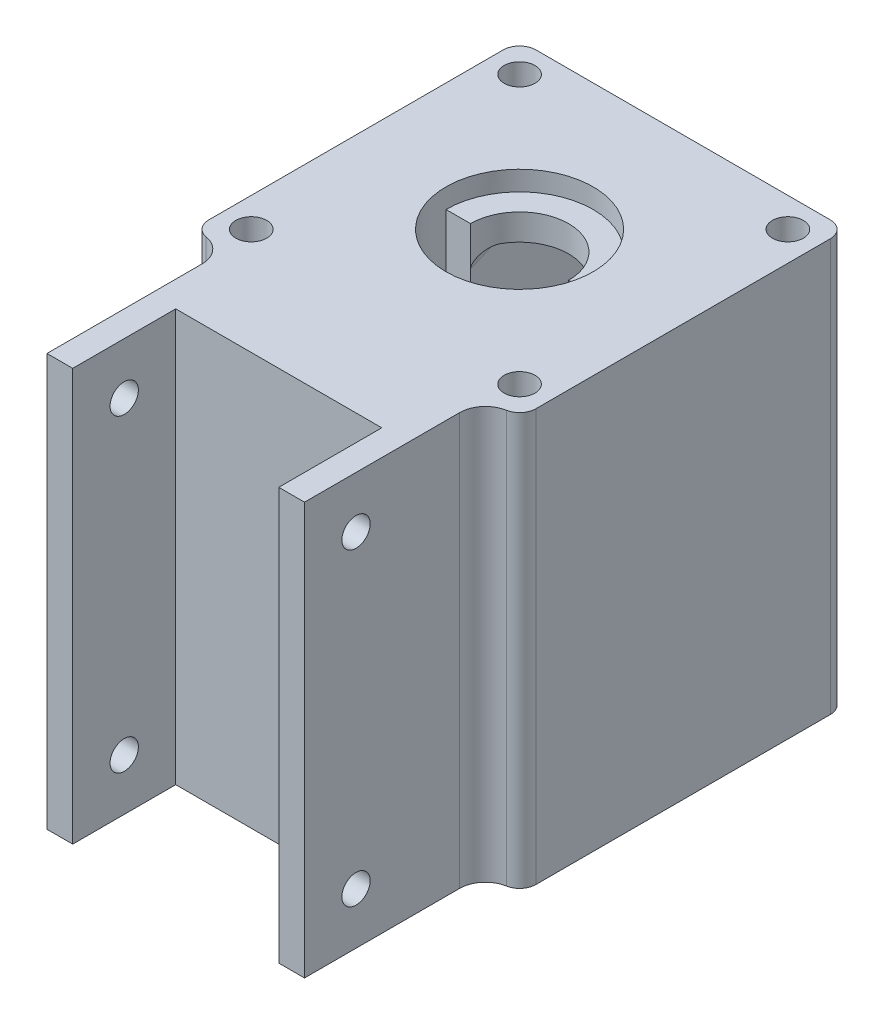
from build123d import *
from build123d.topology import SkipClean

# Parameters (mm, degrees)
SKETCH2_W                      = 63.5
SKETCH2_H                      = 63.5
BOSS_EXTRUDE1_DEPTH            = 80
CUT_EXTRUDE1_REACH             = 93.739
SKETCH4_R                      = 14.2875
CUT_EXTRUDE2_DEPTH             = 3.81
CUT_EXTRUDE3_DEPTH             = 62.22
CUT_EXTRUDE4_REACH             = 93.739
CUT_EXTRUDE4_DIRECTION_2_REACH = 93.739
FILLET2_R                      = 2.54
SKETCH9_W                      = 5
SKETCH9_H                      = 80
BOSS_EXTRUDE2_DEPTH            = 35
SKETCH10_R                     = 2.75
CUT_EXTRUDE6_DEPTH             = 119.642846392
CUT_EXTRUDE7_REACH             = 110.92
SKETCH11_R                     = 3
SKETCH12_W                     = 40
SKETCH12_H                     = 80
BOSS_EXTRUDE3_DEPTH            = 15
SKETCH13_R                     = 3
CUT_EXTRUDE8_DEPTH             = 10
FILLET3_R                      = 3.175
FILLET4_DEPTH                  = 80


with BuildPart() as part:
    # Sketch2 → Boss-Extrude1 (new body)
    with BuildSketch(Plane(origin=(0, 0, 0), x_dir=(1, 0, 0), z_dir=(0, 1, 0))):
        Rectangle(SKETCH2_W, SKETCH2_H)
    extrude(amount=BOSS_EXTRUDE1_DEPTH)

    # Sketch3 → Cut-Extrude1 (cut, up to next)
    with BuildSketch(Plane(origin=(0, 80, 0), x_dir=(1, 0, 0), z_dir=(0, 1, 0)), mode=Mode.PRIVATE) as cut_extrude1_sk1:
        with BuildLine():
            Line((9.525, 0), (14.2875, 0))
            ThreePointArc((14.2875, 0), (0, -14.2875), (-14.2875, 0))
            Line((-14.2875, 0), (-9.525, 0))
            ThreePointArc((-9.525, 0), (0, 9.525), (9.525, 0))
        make_face()
    cut_extrude1_tool1 = extrude(cut_extrude1_sk1.sketch, amount=-CUT_EXTRUDE1_REACH, mode=Mode.PRIVATE) & part.part
    add(cut_extrude1_tool1.solids().sort_by_distance((0, 80, 2.954161))[0], mode=Mode.SUBTRACT)

    # Sketch4 → Cut-Extrude2 (cut)
    with BuildSketch(Plane(origin=(0, 80, 0), x_dir=(1, 0, 0), z_dir=(0, 1, 0))):
        with Locations(Location((0, 0, 0), (0, 0, 270))):
            Circle(SKETCH4_R)
    extrude(amount=-CUT_EXTRUDE2_DEPTH, mode=Mode.SUBTRACT)

    # Sketch6 → Cut-Extrude3 (cut)
    with BuildSketch(Plane(origin=(0, 71.11, 0), x_dir=(1, 0, 0), z_dir=(0, 1, 0))):
        with BuildLine():
            Line((9.525, 0), (19.05, 31.75))
            Line((19.05, 31.75), (-19.05, 31.75))
            Line((-19.05, 31.75), (-9.525, 0))
            ThreePointArc((-9.525, 0), (0, 9.525), (9.525, 0))
        make_face()
    extrude(amount=-CUT_EXTRUDE3_DEPTH, mode=Mode.SUBTRACT)

    # Cut-Extrude4: up to this plane
    with SkipClean():  # the faces are left unmerged after this step: merging them gives an invalid solid
        cut_extrude4_end = Plane(origin=(-9.525, -49.595085442, 0), z_dir=(-0.9578262852211514, 0, 0.2873478855663456))
        # Sketch7 → Cut-Extrude4 (cut, up to the surface)
        with BuildSketch(Plane(origin=(0, 0, 0), x_dir=(0, 0, -1), z_dir=(1, 0, 0)), mode=Mode.PRIVATE) as cut_extrude4_sk1:
            Polygon((0, 8.89), (31.75, 8.89), (0, 0), align=None)
        cut_extrude4_tool1 = split(extrude(cut_extrude4_sk1.sketch, amount=-CUT_EXTRUDE4_REACH, mode=Mode.PRIVATE), bisect_by=cut_extrude4_end, keep=Keep.BOTH, mode=Mode.PRIVATE)
        add(cut_extrude4_tool1.solids().sort_by_distance((0, 5.926667, -10.583333))[0], mode=Mode.SUBTRACT)

    # Cut-Extrude4 direction 2: up to this plane
    cut_extrude4_direction_2_end = Plane(origin=(9.525, -49.595085442, 0), z_dir=(0.9578262852211514, 0, 0.2873478855663456))
    # Sketch7 → Cut-Extrude4 direction 2 (cut, up to the surface)
    with BuildSketch(Plane(origin=(0, 0, 0), x_dir=(0, 0, -1), z_dir=(1, 0, 0)), mode=Mode.PRIVATE) as cut_extrude4_direction_2_sk1:
        Polygon((0, 8.89), (31.75, 8.89), (0, 0), align=None)
    cut_extrude4_direction_2_tool1 = split(extrude(cut_extrude4_direction_2_sk1.sketch, amount=CUT_EXTRUDE4_DIRECTION_2_REACH, mode=Mode.PRIVATE), bisect_by=cut_extrude4_direction_2_end, keep=Keep.BOTH, mode=Mode.PRIVATE)
    add(cut_extrude4_direction_2_tool1.solids().sort_by_distance((0, 5.926667, -10.583333))[0], mode=Mode.SUBTRACT)

    # Fillet2
    # the kernel refuses this fillet: 2.54 mm, written as the material it adds along each edge
    with BuildSketch(Plane(origin=(7.700340927, 71.11, 6.082196911), x_dir=(-0.9578262852211513, 0, -0.2873478855663455), z_dir=(0.28734788556634555, 0, -0.9578262852211513))) as fillet2_piece_1_section:
        with BuildLine():
            CenterArc((FILLET2_R, -FILLET2_R), FILLET2_R, 90, 90)
            Line((0, -FILLET2_R), (0, 0))
            Line((0, 0), (FILLET2_R, 0))
        make_face()
    fillet2_piece_1 = extrude(amount=45.847973166, mode=Mode.PRIVATE)
    fillet2_piece_1 = split(fillet2_piece_1, bisect_by=Plane(origin=(7.700340927, 71.11, -31.75), z_dir=(0, 0, 1)), keep=Keep.TOP, mode=Mode.PRIVATE)
    fillet2_piece_1 = fillet2_piece_1 - Plane(origin=(0, 71.11, 0), x_dir=(-1, 0, 0), z_dir=(0, 1, 0)) * Cylinder(9.525, 102, mode=Mode.PRIVATE)
    fillet2_piece_1 = split(fillet2_piece_1, bisect_by=Plane(origin=(7.700340927, 71.11, 0), z_dir=(0, 0, -1)), keep=Keep.TOP, mode=Mode.PRIVATE)
    add(fillet2_piece_1)
    with BuildSketch(Plane(origin=(-20.874659073, 71.11, -37.832196911), x_dir=(0, -1, 0), z_dir=(0.28734788556634555, 0, 0.9578262852211513))) as fillet2_piece_2_section:
        with BuildLine():
            CenterArc((FILLET2_R, FILLET2_R), FILLET2_R, 180, 90)
            Line((0, FILLET2_R), (0, 0))
            Line((0, 0), (FILLET2_R, 0))
        make_face()
    fillet2_piece_2 = extrude(amount=45.847973166, mode=Mode.PRIVATE)
    fillet2_piece_2 = split(fillet2_piece_2, bisect_by=Plane(origin=(-20.874659073, 71.11, -31.75), z_dir=(0, 0, 1)), keep=Keep.TOP, mode=Mode.PRIVATE)
    fillet2_piece_2 = split(fillet2_piece_2, bisect_by=Plane(origin=(-20.874659073, 71.11, 0), z_dir=(0, 0, -1)), keep=Keep.TOP, mode=Mode.PRIVATE)
    fillet2_piece_2 = fillet2_piece_2 - Plane(origin=(0, 71.11, 0), x_dir=(-1, 0, 0), z_dir=(0, 1, 0)) * Cylinder(9.525, 102, mode=Mode.PRIVATE)
    add(fillet2_piece_2)
    with BuildSketch(Plane(origin=(-20.954648619, 10.667672044, -38.098828729), x_dir=(0.9607141016314922, 0.07483307171461691, -0.2672609704093551), z_dir=(0.2775399339309484, -0.2590372716688848, 0.9251331131031606))) as fillet2_piece_3_section:
        with BuildLine():
            CenterArc((FILLET2_R * 1.08072615035, FILLET2_R), FILLET2_R, 175.556407911, 94.443592089)
            Line((FILLET2_R * 0.0837320564804, FILLET2_R * 1.07747758898), (0, 0))
            Line((0, 0), (FILLET2_R * 1.08072615035, 0))
        make_face()
    fillet2_piece_3 = extrude(amount=52.848435405, mode=Mode.PRIVATE)
    fillet2_piece_3 = split(fillet2_piece_3, bisect_by=Plane(origin=(-20.954648619, 10.667672044, -31.75), z_dir=(0, 0, 1)), keep=Keep.TOP, mode=Mode.PRIVATE)
    fillet2_piece_3 = fillet2_piece_3 - Plane(origin=(0, 10.667672044, 0), x_dir=(-1, 0, 0), z_dir=(0, 1, 0)) * Cylinder(9.525, 117, mode=Mode.PRIVATE)
    fillet2_piece_3 = split(fillet2_piece_3, bisect_by=Plane(origin=(-20.954648619, 10.667672044, 0), z_dir=(0, 0, -1)), keep=Keep.TOP, mode=Mode.PRIVATE)
    add(fillet2_piece_3)
    with BuildSketch(Plane(origin=(20.954648619, 10.667672044, -38.098828729), x_dir=(-0.9607141016314922, 0.07483307171461691, -0.2672609704093551), z_dir=(-0.2775399339309484, -0.2590372716688848, 0.9251331131031606))) as fillet2_piece_4_section:
        with BuildLine():
            CenterArc((FILLET2_R * 1.08072615035, -FILLET2_R), FILLET2_R, 90, 94.443592089)
            Line((FILLET2_R * 0.0837320564804, -FILLET2_R * 1.07747758898), (0, 0))
            Line((0, 0), (FILLET2_R * 1.08072615035, 0))
        make_face()
    fillet2_piece_4 = extrude(amount=52.848435405, mode=Mode.PRIVATE)
    fillet2_piece_4 = split(fillet2_piece_4, bisect_by=Plane(origin=(20.954648619, 10.667672044, -31.75), z_dir=(0, 0, 1)), keep=Keep.TOP, mode=Mode.PRIVATE)
    fillet2_piece_4 = fillet2_piece_4 - Plane(origin=(0, 10.667672044, 0), x_dir=(-1, 0, 0), z_dir=(0, 1, 0)) * Cylinder(9.525, 117, mode=Mode.PRIVATE)
    fillet2_piece_4 = split(fillet2_piece_4, bisect_by=Plane(origin=(20.954648619, 10.667672044, 0), z_dir=(0, 0, -1)), keep=Keep.TOP, mode=Mode.PRIVATE)
    add(fillet2_piece_4)

    # Sketch9 → Boss-Extrude2 (add)
    with BuildSketch(Plane.XY.offset(31.75)):
        with Locations((-22.5, 40)):
            Rectangle(SKETCH9_W, SKETCH9_H)
        with Locations((22.5, 40)):
            Rectangle(SKETCH9_W, SKETCH9_H)
    extrude(amount=BOSS_EXTRUDE2_DEPTH)

    # Sketch10 → Cut-Extrude6 (cut, through all)
    with BuildSketch(Plane.ZY.offset(25)):
        with Locations(Location((56.75, 70, 0), (0, 0, 270))):
            Circle(SKETCH10_R)
        with Locations(Location((56.75, 10, 0), (0, 0, 270))):
            Circle(SKETCH10_R)
    extrude(amount=-CUT_EXTRUDE6_DEPTH, mode=Mode.SUBTRACT)

    # Sketch11 → Cut-Extrude7 (cut, up to next)
    with BuildSketch(Plane.XZ, mode=Mode.PRIVATE) as cut_extrude7_sk1:
        with Locations(Location((26.042742751, -26.042742751, 0), (0, 0, 270))):
            Circle(SKETCH11_R)
    cut_extrude7_tool1 = extrude(cut_extrude7_sk1.sketch, amount=-CUT_EXTRUDE7_REACH, mode=Mode.PRIVATE) & part.part
    # Sketch11 → Cut-Extrude7 (cut, up to next)
    with BuildSketch(Plane.XZ, mode=Mode.PRIVATE) as cut_extrude7_sk2:
        with Locations(Location((26.042742751, 26.042742751, 0), (0, 0, 270))):
            Circle(SKETCH11_R)
    cut_extrude7_tool2 = extrude(cut_extrude7_sk2.sketch, amount=-CUT_EXTRUDE7_REACH, mode=Mode.PRIVATE) & part.part
    # Sketch11 → Cut-Extrude7 (cut, up to next)
    with BuildSketch(Plane.XZ, mode=Mode.PRIVATE) as cut_extrude7_sk3:
        with Locations(Location((-26.042742751, -26.042742751, 0), (0, 0, 270))):
            Circle(SKETCH11_R)
    cut_extrude7_tool3 = extrude(cut_extrude7_sk3.sketch, amount=-CUT_EXTRUDE7_REACH, mode=Mode.PRIVATE) & part.part
    # Sketch11 → Cut-Extrude7 (cut, up to next)
    with BuildSketch(Plane.XZ, mode=Mode.PRIVATE) as cut_extrude7_sk4:
        with Locations(Location((-26.042742751, 26.042742751, 0), (0, 0, 270))):
            Circle(SKETCH11_R)
    cut_extrude7_tool4 = extrude(cut_extrude7_sk4.sketch, amount=-CUT_EXTRUDE7_REACH, mode=Mode.PRIVATE) & part.part
    add(cut_extrude7_tool1.solids().sort_by_distance((26.042743, 0, -26.042743))[0], mode=Mode.SUBTRACT)
    add(cut_extrude7_tool2.solids().sort_by_distance((26.042743, 0, 26.042743))[0], mode=Mode.SUBTRACT)
    add(cut_extrude7_tool3.solids().sort_by_distance((-26.042743, 0, -26.042743))[0], mode=Mode.SUBTRACT)
    add(cut_extrude7_tool4.solids().sort_by_distance((-26.042743, 0, 26.042743))[0], mode=Mode.SUBTRACT)

    # Sketch12 → Boss-Extrude3 (add)
    with BuildSketch(Plane.XY.offset(31.75)):
        with Locations((0, 40)):
            Rectangle(SKETCH12_W, SKETCH12_H)
    extrude(amount=BOSS_EXTRUDE3_DEPTH)

    # Sketch13 → Cut-Extrude8 (cut)
    with BuildSketch(Plane(origin=(0, 0, -31.75), x_dir=(-1, 0, 0), z_dir=(0, 0, -1))):
        with Locations((-18.75, 75)):
            Circle(SKETCH13_R)
        with Locations(Location((18.75, 75, 0), (0, 0, 180))):
            Circle(SKETCH13_R)
        with Locations((18.75, 5)):
            Circle(SKETCH13_R)
        with Locations(Location((-18.75, 5, 0), (0, 0, 180))):
            Circle(SKETCH13_R)
    extrude(amount=-CUT_EXTRUDE8_DEPTH, mode=Mode.SUBTRACT)

    # Fillet3
    fillet3_edges = [part.edges().sort_by_distance(p)[0] for p in [
        (31.75, 40, 31.75),
        (-31.75, 40, 31.75),
        (-31.75, 40, -31.75),
        (31.75, 40, -31.75),
    ]]
    fillet(fillet3_edges, radius=FILLET3_R)

    # Fillet4: read off the stored shape, not the designer's step
    # Fillet4 outline → Fillet4 (add)
    with BuildSketch(Plane(origin=(0, 0, 0), x_dir=(1, 0, 0), z_dir=(0, 1, 0))):
        with BuildLine():
            Line((25, -31.75), (25, -36.624844719))
            ThreePointArc((25, -36.624844719), (26.168694859, -33.412197692), (29.128440367, -31.701392291))
            ThreePointArc((29.128440367, -31.701392291), (28.852785416, -31.737824728), (28.575, -31.75))
            Line((28.575, -31.75), (25, -31.75))
        make_face()
        with BuildLine():
            ThreePointArc((-28.575, -31.75), (-28.852785416, -31.737824728), (-29.128440367, -31.701392291))
            ThreePointArc((-29.128440367, -31.701392291), (-26.168694859, -33.412197692), (-25, -36.624844719))
            Line((-25, -36.624844719), (-25, -31.75))
            Line((-25, -31.75), (-28.575, -31.75))
        make_face()
    extrude(amount=FILLET4_DEPTH)


solid = part.part
